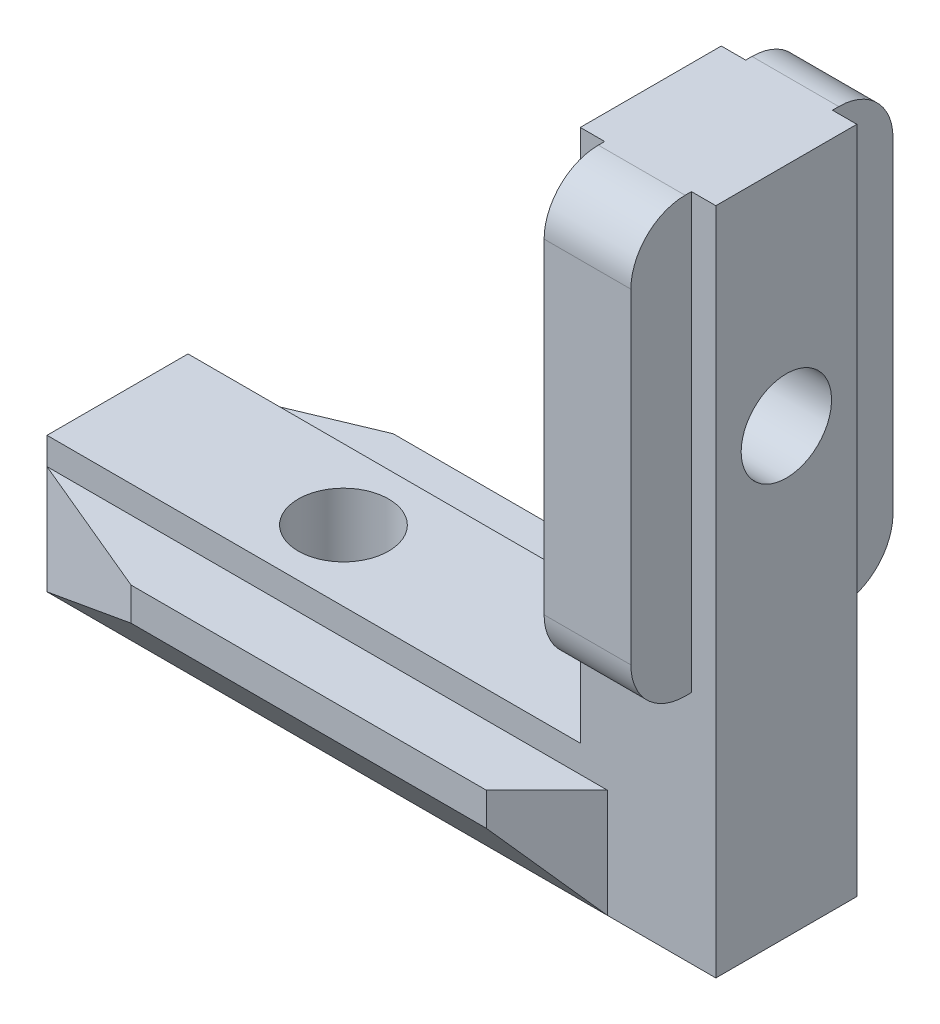
from build123d import *
from OCP.BRepFilletAPI import BRepFilletAPI_MakeChamfer

# Parameters (mm, degrees)
EXTRUDE_1_DEPTH = 3.9
EXTRUDE_2_DEPTH = 35.65
CHAMFER_1_SIZE  = 8
CHAMFER_1_SIZE2 = 3.35
CHAMFER_2_SIZE  = 8
EXTRUDE_3_DEPTH = 2.4


with BuildPart() as part:
    # 草图1 → 凸台-拉伸1 (new, symmetric)
    with BuildSketch(Plane.XY):
        Polygon((-37, 0), (0, 0), (0, 37), (-7.5, 37), (-7.5, 7.5), (-37, 7.5), align=None)
    extrude(amount=EXTRUDE_1_DEPTH, both=True)

    # 草图3 → 凸台-拉伸2 (add)
    with BuildSketch(Plane.ZY.offset(37)):
        Polygon((-3.9, 0), (-7.25, 4.174374383), (-7.25, 6), (-3.9, 6), align=None)
        Polygon((3.9, 6), (3.9, 0), (7.25, 4.174374383), (7.25, 6), align=None)
    extrude(amount=-EXTRUDE_2_DEPTH)

    # 倒角1: one chamfer whose edges measure the first distance from different faces: ONE call of the kernel's chamfer builder (chamfer() names one face for all edges)
    chamfer_1_edges_1 = [part.edges().sort_by_distance(p)[0] for p in [
        (-37, 5.087187192, -7.25),
    ]]
    chamfer_1_side_1 = [part.faces().sort_by_distance(p)[0] for p in [
        (-19.175, 5.087187192, -7.25),
    ]]
    chamfer_1_edges_2 = [part.edges().sort_by_distance(p)[0] for p in [
        (-37, 5.087187192, 7.25),
    ]]
    chamfer_1_side_2 = [part.faces().sort_by_distance(p)[0] for p in [
        (-19.175, 5.087187192, 7.25),
    ]]
    chamfer_1 = BRepFilletAPI_MakeChamfer(part.part.solid().wrapped)
    for e in chamfer_1_edges_1:
        chamfer_1.Add(CHAMFER_1_SIZE, CHAMFER_1_SIZE2, e.wrapped, chamfer_1_side_1[0].wrapped)  # the first distance lies on this face
    for e in chamfer_1_edges_2:
        chamfer_1.Add(CHAMFER_1_SIZE, CHAMFER_1_SIZE2, e.wrapped, chamfer_1_side_2[0].wrapped)  # the first distance lies on this face
    add(Compound.cast(chamfer_1.Shape()), mode=Mode.REPLACE)

    # 倒角2
    # the kernel refuses this chamfer: 8 mm, written as the material it takes off along each edge
    with BuildSketch(Plane(origin=(-1.35, -16.39908952, 7.25), x_dir=(-0.9996219169112968, 0, 0.027495876610586382), z_dir=(0, 1, 0))) as chamfer_2_piece_1_section:
        Polygon((CHAMFER_2_SIZE * 0.999621916911, -CHAMFER_2_SIZE * 0.0274958766106), (-CHAMFER_2_SIZE * 0.0274958766106, -CHAMFER_2_SIZE * 0.999621916911), (0, 0), align=None)
    chamfer_2_piece_1 = extrude(amount=42.972553424, mode=Mode.PRIVATE)
    chamfer_2_piece_1 = split(chamfer_2_piece_1, bisect_by=Plane(origin=(-4.629145345, 5.087187192, 3.9), z_dir=(0, 0, 1)), keep=Keep.TOP, mode=Mode.PRIVATE)
    add(chamfer_2_piece_1, mode=Mode.SUBTRACT)
    with BuildSketch(Plane(origin=(-1.35, -16.39908952, -7.25), x_dir=(-0.9996219169112968, 0, -0.027495876610586382), z_dir=(0, 1, 0))) as chamfer_2_piece_2_section:
        Polygon((CHAMFER_2_SIZE * 0.999621916911, CHAMFER_2_SIZE * 0.0274958766106), (-CHAMFER_2_SIZE * 0.0274958766106, CHAMFER_2_SIZE * 0.999621916911), (0, 0), align=None)
    chamfer_2_piece_2 = extrude(amount=42.972553424, mode=Mode.PRIVATE)
    chamfer_2_piece_2 = split(chamfer_2_piece_2, bisect_by=Plane(origin=(-4.629145345, 5.087187192, -3.9), z_dir=(0, 0, -1)), keep=Keep.TOP, mode=Mode.PRIVATE)
    add(chamfer_2_piece_2, mode=Mode.SUBTRACT)

    # 草图4 → 凸台-拉伸3 (add, symmetric)
    with BuildSketch(Plane.ZY.offset(3.75)):
        with BuildLine():
            Line((-3.9, 37), (-4.25, 37))
            ThreePointArc((-4.25, 37), (-6.371320344, 36.121320344), (-7.25, 34))
            Line((-7.25, 34), (-7.25, 16))
            ThreePointArc((-7.25, 16), (-6.371320344, 13.878679656), (-4.25, 13))
            Line((-4.25, 13), (-3.9, 13))
            Line((-3.9, 13), (-3.9, 37))
        make_face()
        with BuildLine():
            Line((3.9, 37), (3.9, 13))
            Line((3.9, 13), (4.25, 13))
            ThreePointArc((4.25, 13), (6.371320344, 13.878679656), (7.25, 16))
            Line((7.25, 16), (7.25, 34))
            ThreePointArc((7.25, 34), (6.371320344, 36.121320344), (4.25, 37))
            Line((4.25, 37), (3.9, 37))
        make_face()
    extrude(amount=EXTRUDE_3_DEPTH, both=True)

    # 草图6 → M6 螺纹孔1 (revolve, cut)
    with BuildSketch(Plane(origin=(-24.5, 7.5, 0), x_dir=(0, 0, 1), z_dir=(1, 0, 0))):
        Polygon((0, 0), (0, 29.502151548), (2.5, 28), (2.5, 0), align=None)
    hole_wizard_m6_1 = revolve(axis=Axis((-24.5, 13.85, 0), (0, -1, 0)), mode=Mode.SUBTRACT)

    # 镜向1: M6 螺纹孔1 across plane
    add(hole_wizard_m6_1.mirror(Plane(origin=(0, 0, 0), x_dir=(0, 0, 1), z_dir=(-0.7071067811865477, -0.7071067811865475, 0))), mode=Mode.SUBTRACT)


solid = part.part
